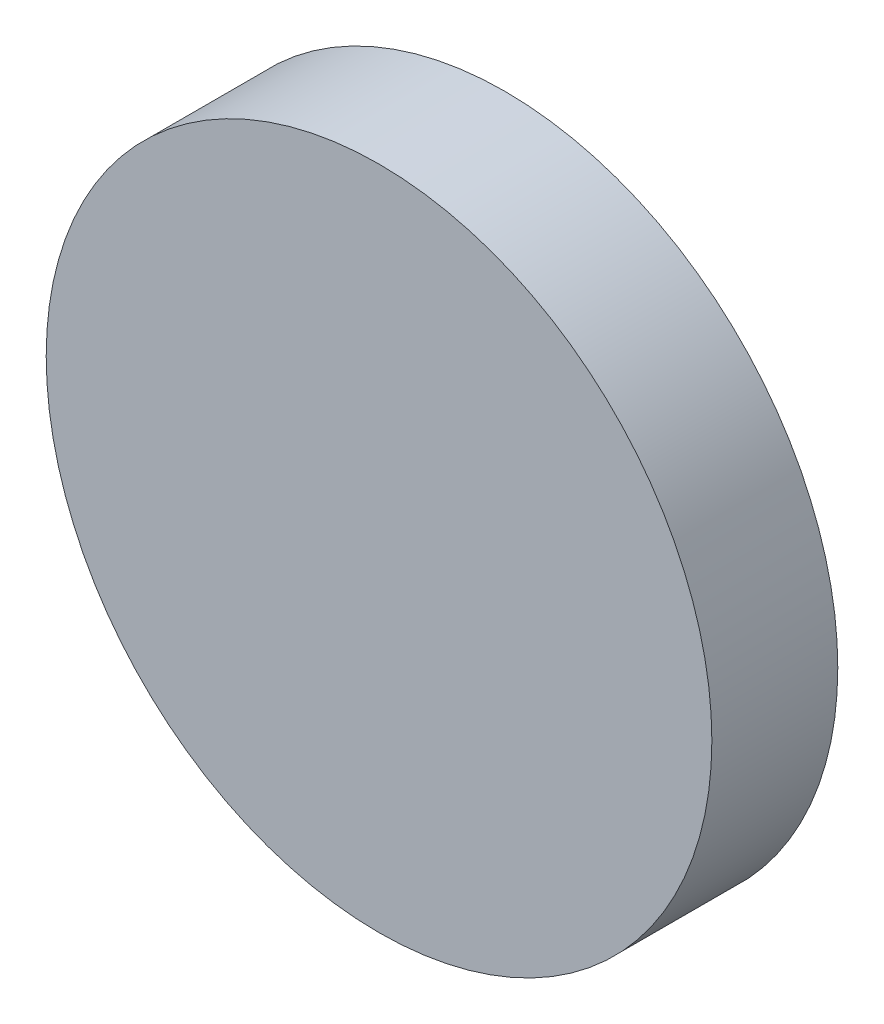
from build123d import *

# Parameters (mm, degrees)
CROQUIS1_R              = 9.25
SALIENTE_EXTRUIR1_DEPTH = 2.5
SALIENTE_EXTRUIR2_DEPTH = 5
CROQUIS1_5_R            = 9.25
SALIENTE_EXTRUIR3_DEPTH = 1
CORTAR_EXTRUIR1_REACH   = 16.511
CROQUIS2_R              = 1.25


with BuildPart() as part:
    # Croquis1 → Saliente-Extruir1 (new body)
    with BuildSketch(Plane.XY):
        Circle(CROQUIS1_R)
    extrude(amount=SALIENTE_EXTRUIR1_DEPTH)

    # Croquis1<4> → Saliente-Extruir2 (add)
    with BuildSketch(Plane.XY):
        with BuildLine():
            ThreePointArc((0.75, 2.90473751), (0, 3), (-0.75, 2.90473751))
            Line((-0.75, 2.90473751), (-0.75, -2.90473751))
            ThreePointArc((-0.75, -2.90473751), (0, -3), (0.75, -2.90473751))
            Line((0.75, -2.90473751), (0.75, 2.90473751))
        make_face()
    extrude(amount=-SALIENTE_EXTRUIR2_DEPTH)

    # Croquis1<5> → Saliente-Extruir3 (add)
    with BuildSketch(Plane.XY):
        Circle(CROQUIS1_5_R)
        with BuildLine():
            ThreePointArc((-0.75, -2.90473751), (-3, 0), (-0.75, 2.90473751))
            ThreePointArc((-0.75, 2.90473751), (0, 3), (0.75, 2.90473751))
            ThreePointArc((0.75, 2.90473751), (2.371708245, 1.837117307), (3, 0))
            ThreePointArc((3, 0), (2.371708245, -1.837117307), (0.75, -2.90473751))
            ThreePointArc((0.75, -2.90473751), (0, -3), (-0.75, -2.90473751))
        make_face(mode=Mode.SUBTRACT)
    extrude(amount=-SALIENTE_EXTRUIR3_DEPTH)

    # Croquis2 → Cortar-Extruir1 (cut, up to next)
    with BuildSketch(Plane(origin=(0.75, 0, 0), x_dir=(0, 0, -1), z_dir=(1, 0, 0)), mode=Mode.PRIVATE) as cortar_extruir1_sk1:
        with Locations((3.1, 0)):
            Circle(CROQUIS2_R)
    cortar_extruir1_tool1 = extrude(cortar_extruir1_sk1.sketch, amount=-CORTAR_EXTRUIR1_REACH, mode=Mode.PRIVATE) & part.part
    add(cortar_extruir1_tool1.solids().sort_by_distance((0.75, 0, -3.1))[0], mode=Mode.SUBTRACT)


solid = part.part
